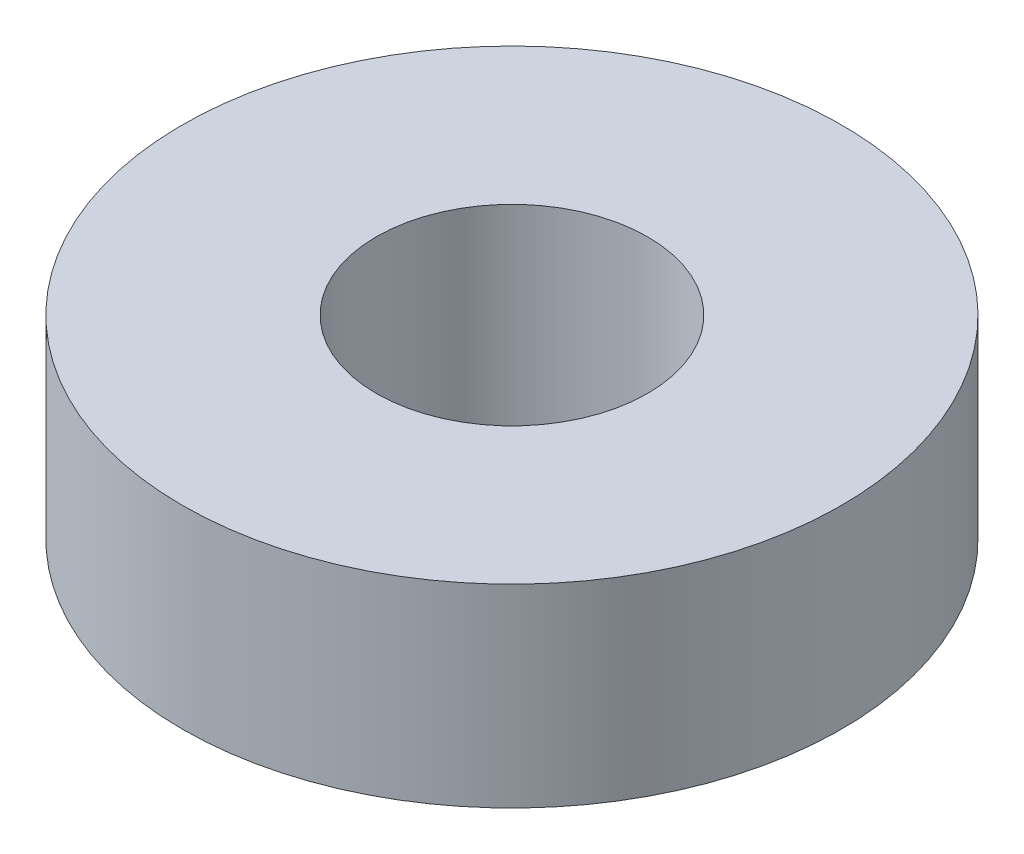
from build123d import *

# Parameters (mm, degrees)
SKETCH1_R           = 42.5
BOSS_EXTRUDE1_DEPTH = 25
SKETCH2_R           = 17.5
CUT_EXTRUDE1_DEPTH  = 66.096082831


with BuildPart() as part:
    # Sketch1 → Boss-Extrude1 (new body)
    with BuildSketch(Plane(origin=(0, 0, 0), x_dir=(1, 0, 0), z_dir=(0, 1, 0))):
        Circle(SKETCH1_R)
    extrude(amount=BOSS_EXTRUDE1_DEPTH)

    # Sketch2 → Cut-Extrude1 (cut, through all)
    with BuildSketch(Plane(origin=(0, 0, 0), x_dir=(1, 0, 0), z_dir=(0, 1, 0))):
        Circle(SKETCH2_R)
    extrude(amount=CUT_EXTRUDE1_DEPTH, mode=Mode.SUBTRACT)


solid = part.part
